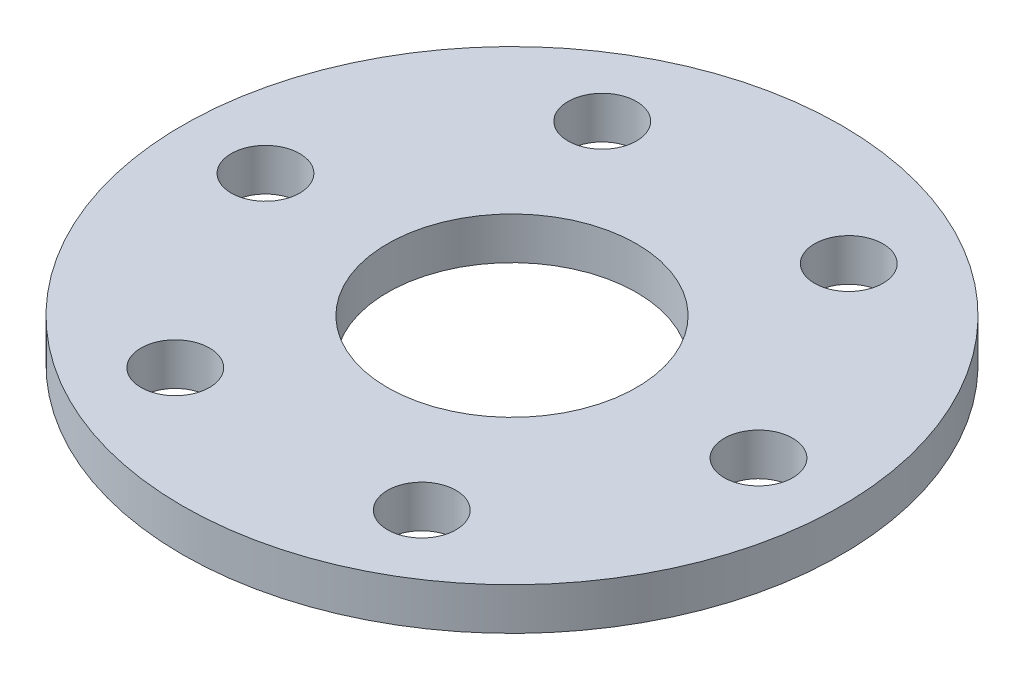
from build123d import *

# Parameters (mm, degrees)
SKETCH1_R            = 31.75
BOSS_EXTRUDE1_DEPTH  = 4.064
M6_CLEARANCE_HOLE1_D = 6.6
SKETCH5_R            = 12
CUT_EXTRUDE1_DEPTH   = 46.084821126


with BuildPart() as part:
    # Sketch1 → Boss-Extrude1 (new body)
    with BuildSketch(Plane(origin=(0, 0, 0), x_dir=(1, 0, 0), z_dir=(0, 1, 0))):
        Circle(SKETCH1_R)
    extrude(amount=BOSS_EXTRUDE1_DEPTH)

    # M6 Clearance Hole1 (through all)
    with Locations(Plane(origin=(0, 4.064, 0), x_dir=(1, 0, 0), z_dir=(0, 1, 0))):
        with Locations((-23.75, 0), (-11.875, 20.56810334), (11.875, 20.56810334), (23.75, 0), (11.875, -20.56810334), (-11.875, -20.56810334)):
            Hole(M6_CLEARANCE_HOLE1_D / 2)

    # Sketch5 → Cut-Extrude1 (cut, through all)
    with BuildSketch(Plane(origin=(0, 4.064, 0), x_dir=(1, 0, 0), z_dir=(0, 1, 0))):
        Circle(SKETCH5_R)
    extrude(amount=-CUT_EXTRUDE1_DEPTH, mode=Mode.SUBTRACT)


solid = part.part
